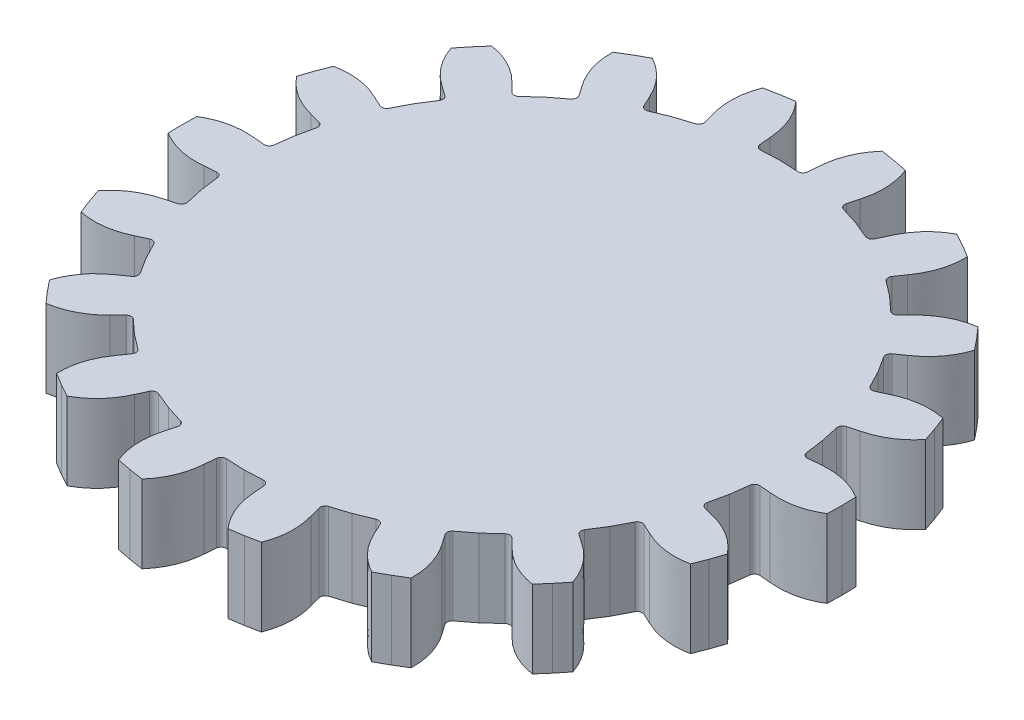
from build123d import *

# Parameters (mm, degrees)
BOSS_EXTRUDE1_DEPTH      = 7.5
FILLET1_R                = 0.5
CIRPATTERN1_COUNT        = 18
FILLET1_OF_CIRPATTERN1_R = 0.5


with BuildPart() as part:
    # Sketch2 → Boss-Extrude1 (new body)
    with BuildSketch(Plane(origin=(0, 0, 0), x_dir=(1, 0, 0), z_dir=(0, 1, 0))):
        with BuildLine():
            Line((-25.739180512, 2.251886503), (-27.285772781, 2.387195794))
            add(Edge.make_bspline(
                [(-27.285772781, 2.387195794), (-29.733321363, 2.631764933), (-31.769733446, 1.387096518)],
                knots=[0, 0, 0, 1, 1, 1], degree=2))
            Line((-31.769733446, 1.387096518), (-31.8, 0))
            Line((-31.8, 0), (-31.769733446, -1.387096518))
            add(Edge.make_bspline(
                [(-27.285772781, -2.387195794), (-29.733321363, -2.631764933), (-31.769733446, -1.387096518)],
                knots=[0, 0, 0, 1, 1, 1], degree=2))
            Line((-27.285772781, -2.387195794), (-25.739180512, -2.251886503))
            Line((-25.739180512, -2.251886503), (-25.444970318, -4.48663479))
            Line((-25.444970318, -4.48663479), (0, 0))
            Line((0, 0), (-25.444970318, 4.48663479))
            Line((-25.444970318, 4.48663479), (-25.739180512, 2.251886503))
        make_face()
    boss_extrude1 = extrude(amount=BOSS_EXTRUDE1_DEPTH)

    # Fillet1
    fillet1_edges = [part.edges().sort_by_distance(p)[0] for p in [
        (-25.739180512, 3.75, -2.251886503),
        (-25.739180512, 3.75, 2.251886503),
    ]]
    fillet(fillet1_edges, radius=FILLET1_R)

    # CirPattern1: Boss-Extrude1 ×18 about axis
    cirpattern1_axis = Axis((0, 7.5, 0), (0, -1, 0))
    for i in range(1, CIRPATTERN1_COUNT):
        add(boss_extrude1.rotate(cirpattern1_axis, i * 360 / CIRPATTERN1_COUNT))

    # Fillet1 of CirPattern1
    fillet1_of_cirpattern1_edges = [part.edges().sort_by_distance(p)[0] for p in [
        (-23.416727448, 3.75, -10.919399338),
        (-24.957108537, 3.75, -6.687237078),
        (-18.269871459, 3.75, -18.269871459),
        (-21.164840944, 3.75, -14.819781174),
        (-10.919399338, 3.75, -23.416727448),
        (-14.819781174, 3.75, -21.164840944),
        (-2.251886503, 3.75, -25.739180512),
        (-6.687237078, 3.75, -24.957108537),
        (6.687237078, 3.75, -24.957108537),
        (2.251886503, 3.75, -25.739180512),
        (14.819781174, 3.75, -21.164840944),
        (10.919399338, 3.75, -23.416727448),
        (21.164840944, 3.75, -14.819781174),
        (18.269871459, 3.75, -18.269871459),
        (24.957108537, 3.75, -6.687237078),
        (23.416727448, 3.75, -10.919399338),
        (25.739180512, 3.75, 2.251886503),
        (25.739180512, 3.75, -2.251886503),
        (23.416727448, 3.75, 10.919399338),
        (24.957108537, 3.75, 6.687237078),
        (18.269871459, 3.75, 18.269871459),
        (21.164840944, 3.75, 14.819781174),
        (10.919399338, 3.75, 23.416727448),
        (14.819781174, 3.75, 21.164840944),
        (2.251886503, 3.75, 25.739180512),
        (6.687237078, 3.75, 24.957108537),
        (-6.687237078, 3.75, 24.957108537),
        (-2.251886503, 3.75, 25.739180512),
        (-14.819781174, 3.75, 21.164840944),
        (-10.919399338, 3.75, 23.416727448),
        (-21.164840944, 3.75, 14.819781174),
        (-18.269871459, 3.75, 18.269871459),
        (-24.957108537, 3.75, 6.687237078),
        (-23.416727448, 3.75, 10.919399338),
    ]]
    fillet(fillet1_of_cirpattern1_edges, radius=FILLET1_OF_CIRPATTERN1_R)


solid = part.part
